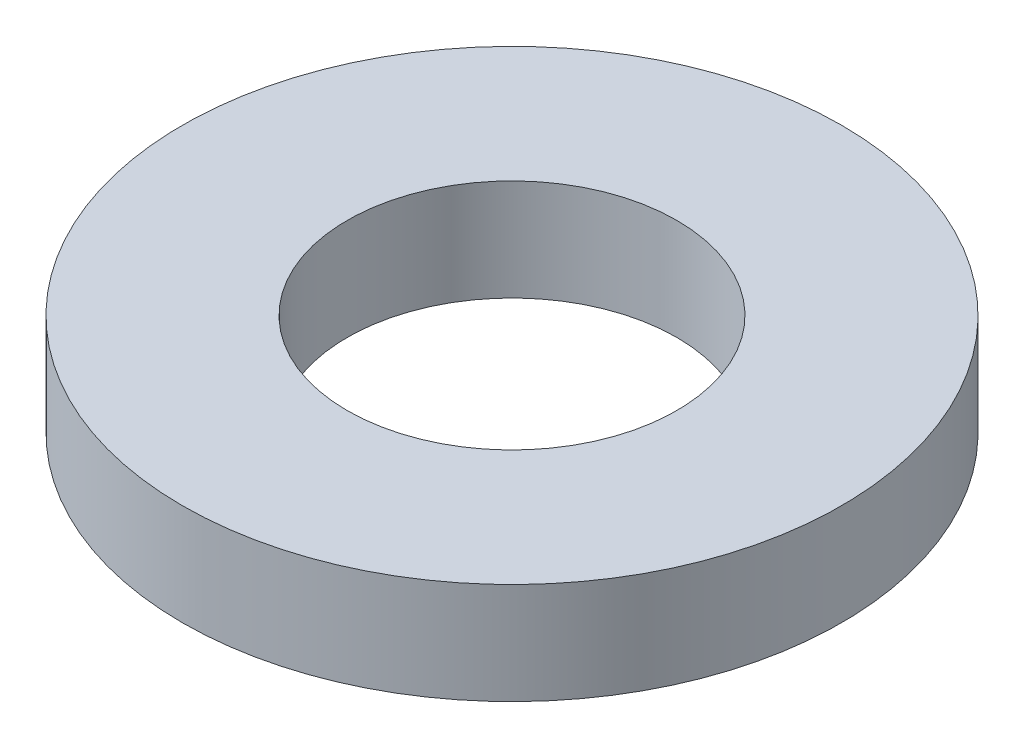
from build123d import *

# Parameters (mm, degrees)
SKETCH1_R           = 65
BOSS_EXTRUDE1_DEPTH = 20
SKETCH2_R           = 32.5
CUT_EXTRUDE1_DEPTH  = 95.074438611


with BuildPart() as part:
    # Sketch1 → Boss-Extrude1 (new body)
    with BuildSketch(Plane(origin=(0, 0, 0), x_dir=(1, 0, 0), z_dir=(0, 1, 0))):
        Circle(SKETCH1_R)
    extrude(amount=BOSS_EXTRUDE1_DEPTH)

    # Sketch2 → Cut-Extrude1 (cut, through all)
    with BuildSketch(Plane(origin=(0, 0, 0), x_dir=(1, 0, 0), z_dir=(0, 1, 0))):
        Circle(SKETCH2_R)
    extrude(amount=CUT_EXTRUDE1_DEPTH, mode=Mode.SUBTRACT)


solid = part.part
